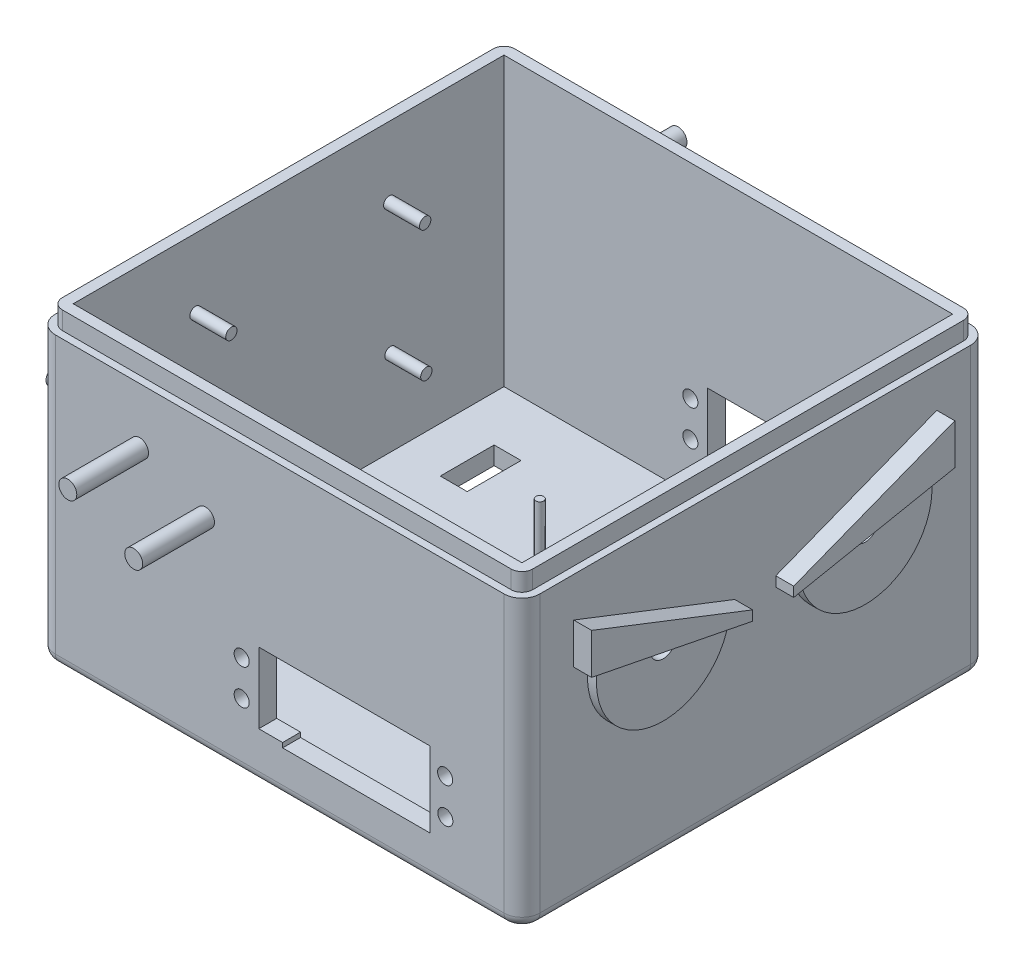
from build123d import *

# Parameters (mm, degrees)
SKETCH1_W               = 135
SKETCH1_H               = 130
BOSS_EXTRUDE1_DEPTH     = 80
FILLET3_R               = 5
SHELL4_START            = -60.909090909
SHELL4_OUTLINE_W        = 75
SHELL4_OUTLINE_H        = 120
SHELL4_DEPTH            = 125
BOSS_EXTRUDE5_DEPTH     = 5
SKETCH12_W              = 125
SKETCH12_H              = 120
CUT_EXTRUDE7_DEPTH      = 30
SKETCH51_R              = 2.1
SKETCH51_W              = 39.9
SKETCH51_H              = 19.7
CUT_EXTRUDE8_DEPTH      = 170.995746179
SKETCH52_R              = 2.5
BOSS_EXTRUDE29_DEPTH    = 20
BOSS_EXTRUDE30_START    = 20
SKETCH53_R              = 2.5
BOSS_EXTRUDE30_DEPTH    = 20
SKETCH54_R              = 1.097354929
SKETCH54_R_2            = 1.097354846
SKETCH54_R_3            = 1.097350713
SKETCH54_R_4            = 1.097352291
BOSS_EXTRUDE31_DEPTH    = 15
SKETCH55_R              = 1.493597511
SKETCH55_R_2            = 1.49359734
BOSS_EXTRUDE32_DEPTH    = 10
SKETCH56_R              = 2.923618592
BOSS_EXTRUDE33_DEPTH    = 5
SKETCH58_R              = 1.583892905
SKETCH58_R_2            = 1.583857327
SKETCH58_R_3            = 1.583793031
SKETCH58_R_4            = 1.583675268
BOSS_EXTRUDE35_DEPTH    = 10
SKETCH60_W              = 7.5
SKETCH60_H              = 15
CUT_EXTRUDE10_DEPTH     = 10
SKETCH61_R              = 8
BOSS_EXTRUDE36_DEPTH    = 5
SKETCH62_R              = 2.5
BOSS_EXTRUDE37_DEPTH    = 15
BOSS_EXTRUDE38_DEPTH    = 2.5
BOSS_EXTRUDE39_DEPTH    = 5
CUT_EXTRUDE11_DEPTH     = 5
FILLET4_R               = 3
CUT_EXTRUDE5_DEPTH      = 191.450206069
CUT_EXTRUDE5_DEPTH_BACK = 191.450206069
SKETCH14_W              = 41
SKETCH14_H              = 21
SKETCH38_R              = 2.499995695
BOSS_EXTRUDE19_DEPTH    = 20
SKETCH39_R              = 2.099929147
SKETCH39_R_2            = 2.1
CUT_EXTRUDE6_DEPTH      = 191.450206069
BOSS_EXTRUDE20_START    = 20
SKETCH40_R              = 2.499995695
BOSS_EXTRUDE20_DEPTH    = 20
SKETCH41_R              = 1.743340357
SKETCH41_R_2            = 1.74334297
SKETCH41_R_3            = 1.743341919
SKETCH41_R_4            = 1.743340762
BOSS_EXTRUDE21_DEPTH    = 10
SKETCH42_R              = 1.583857307
SKETCH42_R_2            = 1.583793042
SKETCH42_R_3            = 1.58367528
SKETCH42_R_4            = 1.583892837
BOSS_EXTRUDE22_DEPTH    = 10
SKETCH43_R              = 1.097354928
SKETCH43_R_2            = 1.097354845
SKETCH43_R_3            = 1.097350705
SKETCH43_R_4            = 1.097352292
BOSS_EXTRUDE23_DEPTH    = 15
SKETCH48_R              = 2.891630162
BOSS_EXTRUDE27_DEPTH    = 5
SKETCH49_R              = 1.493597522
SKETCH49_R_2            = 1.49359734
BOSS_EXTRUDE28_DEPTH    = 10


# Read off the part's stored shape, not the designer's step: Shell4
with BuildPart() as part:
    # Sketch1 → Boss-Extrude1 (new body)
    with BuildSketch(Plane(origin=(0, 0, 0), x_dir=(1, 0, 0), z_dir=(0, 1, 0))):
        with Locations((1.590909091, 2.110628243)):
            Rectangle(SKETCH1_W, SKETCH1_H)
    extrude(amount=BOSS_EXTRUDE1_DEPTH)

    # Fillet3
    fillet3_edges = [part.edges().sort_by_distance(p)[0] for p in [
        (-65.909090909, 40, -67.110628243),
        (69.090909091, 40, -67.110628243),
        (69.090909091, 40, 62.889371757),
        (-65.909090909, 40, 62.889371757),
    ]]
    fillet(fillet3_edges, radius=FILLET3_R)

    # Shell4 outline → Shell4 (cut)
    with BuildSketch(Plane.YZ.offset(SHELL4_START)):
        with Locations((42.5, -2.110628243)):
            Rectangle(SHELL4_OUTLINE_W, SHELL4_OUTLINE_H)
    extrude(amount=SHELL4_DEPTH, mode=Mode.SUBTRACT)

    # Sketch6 → Boss-Extrude5 (add)
    with BuildSketch(Plane(origin=(0, 80, 0), x_dir=(1, 0, 0), z_dir=(0, 1, 0))):
        with BuildLine():
            Line((-60.909090909, -60.889371757), (64.090909091, -60.889371757))
            ThreePointArc((64.090909091, -60.889371757), (66.212229434, -60.010692101), (67.090909091, -57.889371757))
            Line((67.090909091, -57.889371757), (67.090909091, 62.110628243))
            ThreePointArc((67.090909091, 62.110628243), (66.212229434, 64.231948586), (64.090909091, 65.110628243))
            Line((64.090909091, 65.110628243), (-60.909090909, 65.110628243))
            ThreePointArc((-60.909090909, 65.110628243), (-63.030411253, 64.231948586), (-63.909090909, 62.110628243))
            Line((-63.909090909, 62.110628243), (-63.909090909, -57.889371757))
            ThreePointArc((-63.909090909, -57.889371757), (-63.030411253, -60.010692101), (-60.909090909, -60.889371757))
        make_face()
    extrude(amount=BOSS_EXTRUDE5_DEPTH)

    # Sketch12 → Cut-Extrude7 (cut)
    with BuildSketch(Plane(origin=(0, 85, 0), x_dir=(1, 0, 0), z_dir=(0, 1, 0))):
        with Locations((1.590909091, 2.110628243)):
            Rectangle(SKETCH12_W, SKETCH12_H)
    extrude(amount=-CUT_EXTRUDE7_DEPTH, mode=Mode.SUBTRACT)

    # Sketch51 → Cut-Extrude8 (cut, through all)
    with BuildSketch(Plane.XY.offset(62.889371757)):
        with Locations((-8.984223689, 28.081935568)):
            Circle(SKETCH51_R)
        with Locations((-8.984223689, 18.231935568)):
            Circle(SKETCH51_R)
        with Locations((40.438067547, 28.081935568)):
            Circle(SKETCH51_R)
        with Locations((40.438067547, 18.231935568)):
            Circle(SKETCH51_R)
        with Locations((15.726921929, 23.156935568)):
            Rectangle(SKETCH51_W, SKETCH51_H)
    extrude(amount=-CUT_EXTRUDE8_DEPTH, mode=Mode.SUBTRACT)

    # Sketch52 → Boss-Extrude29 (add)
    with BuildSketch(Plane.XY.offset(62.889371757)):
        with Locations(Location((-37.424099567, 64.448146968, 0), (0, 0, 180))):
            Circle(SKETCH52_R)
    extrude(amount=BOSS_EXTRUDE29_DEPTH)

    # Sketch53 → Boss-Extrude30 (add)
    with BuildSketch(Plane(origin=(0, 0, -67.110628243), x_dir=(-1, 0, 0), z_dir=(0, 0, -1)).offset(BOSS_EXTRUDE30_START)):
        with Locations((37.424099567, 64.448146968)):
            Circle(SKETCH53_R)
    extrude(amount=-BOSS_EXTRUDE30_DEPTH)

    # Sketch54 → Boss-Extrude31 (add)
    with BuildSketch(Plane(origin=(0, 5, 0), x_dir=(1, 0, 0), z_dir=(0, 1, 0))):
        with Locations(Location((-13.882974331, 25.052366393, 0), (0, 0, 270))):
            Circle(SKETCH54_R)
        with Locations(Location((37.009034905, 10.261178321, 0), (0, 0, 270))):
            Circle(SKETCH54_R_2)
        with Locations(Location((37.252493084, -17.646611168, 0), (0, 0, 270))):
            Circle(SKETCH54_R_3)
        with Locations(Location((-14.731567108, -23.178787611, 0), (0, 0, 270))):
            Circle(SKETCH54_R_4)
    extrude(amount=BOSS_EXTRUDE31_DEPTH)

    # Sketch55 → Boss-Extrude32 (add)
    with BuildSketch(Plane(origin=(0, 5, 0), x_dir=(1, 0, 0), z_dir=(0, 1, 0))):
        with Locations(Location((59.280875612, 10.746107148, 0), (0, 0, 270))):
            Circle(SKETCH55_R)
        with Locations(Location((59.381101783, -5.253577831, 0), (0, 0, 270))):
            Circle(SKETCH55_R_2)
    extrude(amount=BOSS_EXTRUDE32_DEPTH)

    # Sketch56 → Boss-Extrude33 (add)
    with BuildSketch(Plane(origin=(0, 5, 0), x_dir=(1, 0, 0), z_dir=(0, 1, 0))):
        with Locations(Location((54.807940882, 1.102663458, 0), (0, 0, 270))):
            Circle(SKETCH56_R)
    extrude(amount=BOSS_EXTRUDE33_DEPTH)

    # Sketch58 → Boss-Extrude35 (add)
    with BuildSketch(Plane(origin=(-60.909090909, 0, 0), x_dir=(0, 0, -1), z_dir=(1, 0, 0))):
        with Locations((-23.825052013, 65.769783842)):
            Circle(SKETCH58_R)
        with Locations((30.159505374, 65.455170881)):
            Circle(SKETCH58_R_2)
        with Locations((30.483812669, 28.939401841)):
            Circle(SKETCH58_R_3)
        with Locations((-23.494114633, 28.460414527)):
            Circle(SKETCH58_R_4)
    extrude(amount=BOSS_EXTRUDE35_DEPTH)

    # Sketch60 → Cut-Extrude10 (cut)
    with BuildSketch(Plane(origin=(0, 5, 0), x_dir=(1, 0, 0), z_dir=(0, 1, 0))):
        with Locations((-43.894273907, -31.311500115)):
            Rectangle(SKETCH60_W, SKETCH60_H)
        with Locations((-44.460730283, 39.165032156)):
            Rectangle(SKETCH60_W, SKETCH60_H)
    extrude(amount=-CUT_EXTRUDE10_DEPTH, mode=Mode.SUBTRACT)

    # Sketch61 → Boss-Extrude36 (add)
    with BuildSketch(Plane.ZY.offset(65.909090909)):
        with Locations(Location((26.420628094, 32.425519239, 0), (0, 0, 180))):
            Circle(SKETCH61_R)
    extrude(amount=BOSS_EXTRUDE36_DEPTH)

    # Sketch62 → Boss-Extrude37 (add)
    with BuildSketch(Plane.ZY.offset(65.909090909)):
        with Locations(Location((2.979358583, 50.286508583, 0), (0, 0, 180))):
            Circle(SKETCH62_R)
        with Locations(Location((42.979358583, 50.286508583, 0), (0, 0, 180))):
            Circle(SKETCH62_R)
        with Locations(Location((41.91526883, 10.864110099, 0), (0, 0, 180))):
            Circle(SKETCH62_R)
        with Locations(Location((2.979358583, 10.441006071, 0), (0, 0, 180))):
            Circle(SKETCH62_R)
    extrude(amount=BOSS_EXTRUDE37_DEPTH)

    # Sketch66 → Boss-Extrude38 (add)
    with BuildSketch(Plane(origin=(69.090909091, 0, 0), x_dir=(0, 0, -1), z_dir=(1, 0, 0))):
        with BuildLine():
            Line((-44.270425373, 56.797242998), (-7.812088138, 49.599459681))
            ThreePointArc((-7.812088138, 49.599459681), (-29.640148414, 34.969182723), (-44.270425373, 56.797242998))
        make_face()
    boss_extrude38 = extrude(amount=BOSS_EXTRUDE38_DEPTH)

    # Sketch64 → Boss-Extrude39 (add)
    with BuildSketch(Plane(origin=(69.090909091, 0, 0), x_dir=(0, 0, -1), z_dir=(1, 0, 0))):
        Polygon((-48.473573965, 68.982815523), (-48.473573965, 57.627049158), (-3.608939546, 48.769653522), (-3.608939546, 51.506862595), align=None)
    boss_extrude39 = extrude(amount=BOSS_EXTRUDE39_DEPTH)

    # Sketch69 → Cut-Extrude11 (cut)
    with BuildSketch(Plane(origin=(69.090909091, 0, 0), x_dir=(0, 0, -1), z_dir=(1, 0, 0))):
        with BuildLine():
            Line((-29.513282432, 53.883815636), (-22.569231079, 52.512887043))
            ThreePointArc((-22.569231079, 52.512887043), (-26.726721052, 49.726325664), (-29.513282432, 53.883815636))
        make_face()
    cut_extrude11 = extrude(amount=CUT_EXTRUDE11_DEPTH, mode=Mode.SUBTRACT)

    # Mirror3: Boss-Extrude38, Boss-Extrude39, Cut-Extrude11 across plane
    add(boss_extrude38.mirror(Plane.XY.offset(-2.110628243)))
    add(boss_extrude39.mirror(Plane.XY.offset(-2.110628243)))
    add(cut_extrude11.mirror(Plane.XY.offset(-2.110628243)), mode=Mode.SUBTRACT)

    # Fillet4
    fillet4_edges = [part.edges().sort_by_distance(p)[0] for p in [
        (69.090909091, 0, -2.110628243),
        (-65.909090909, 0, -2.110628243),
        (1.590909091, 0, -67.110628243),
        (1.590909091, 0, 62.889371757),
        (-64.444624815, 0, -65.646162149),
        (67.626442997, 0, -65.646162149),
        (-64.444624815, 0, 61.424905663),
        (67.626442997, 0, 61.424905663),
    ]]
    fillet(fillet4_edges, radius=FILLET4_R)

    # Sketch14 → Cut-Extrude5 (cut, two sides: drawn at the far end of the back side and taken through both)
    with BuildSketch(Plane(origin=(0, 0, -67.110628243), x_dir=(-1, 0, 0), z_dir=(0, 0, -1)).offset(-CUT_EXTRUDE5_DEPTH_BACK)):
        with Locations((-22.915856751, 22.506935568)):
            Rectangle(SKETCH14_W, SKETCH14_H)
    extrude(amount=CUT_EXTRUDE5_DEPTH + CUT_EXTRUDE5_DEPTH_BACK, mode=Mode.SUBTRACT)

    # Sketch38 → Boss-Extrude19 (add)
    with BuildSketch(Plane.XY.offset(62.889371757)):
        with Locations(Location((-19.064354595, 56.892914504, 0), (0, 0, 180))):
            Circle(SKETCH38_R)
    extrude(amount=BOSS_EXTRUDE19_DEPTH)

    # Sketch39 → Cut-Extrude6 (cut, through all)
    with BuildSketch(Plane.XY.offset(62.889371757)):
        with Locations((47.698527272, 27.837999273)):
            Circle(SKETCH39_R)
        with Locations((47.753956504, 17.988233098)):
            Circle(SKETCH39_R)
        with Locations((-1.666283345, 17.711534904)):
            Circle(SKETCH39_R_2)
        with Locations((-1.704515098, 27.570940529)):
            Circle(SKETCH39_R)
    extrude(amount=-CUT_EXTRUDE6_DEPTH, mode=Mode.SUBTRACT)

    # Sketch40 → Boss-Extrude20 (add)
    with BuildSketch(Plane(origin=(0, 0, -67.110628243), x_dir=(-1, 0, 0), z_dir=(0, 0, -1)).offset(BOSS_EXTRUDE20_START)):
        with Locations((19.064354595, 56.892914504)):
            Circle(SKETCH40_R)
    extrude(amount=-BOSS_EXTRUDE20_DEPTH)

    # Sketch41 → Boss-Extrude21 (add)
    with BuildSketch(Plane.ZY.offset(65.909090909)):
        with Locations(Location((-52.504515626, 59.75868372, 0), (0, 0, 180))):
            Circle(SKETCH41_R)
        with Locations(Location((15.528981547, 62.790814483, 0), (0, 0, 180))):
            Circle(SKETCH41_R_2)
        with Locations(Location((-15.204516125, 18.75868119, 0), (0, 0, 180))):
            Circle(SKETCH41_R_3)
        with Locations(Location((-52.504515626, 18.758684916, 0), (0, 0, 180))):
            Circle(SKETCH41_R_4)
    extrude(amount=BOSS_EXTRUDE21_DEPTH)

    # Sketch42 → Boss-Extrude22 (add)
    with BuildSketch(Plane(origin=(-60.909090909, 0, 0), x_dir=(0, 0, -1), z_dir=(1, 0, 0))):
        with Locations((30.15950535, 65.45517088)):
            Circle(SKETCH42_R)
        with Locations((30.483812669, 28.939401841)):
            Circle(SKETCH42_R_2)
        with Locations(Location((-23.494114636, 28.460414515, 0), (0, 0, 4.3e-07))):
            Circle(SKETCH42_R_3)
        with Locations(Location((-23.825052085, 65.769783916, 0), (0, 0, 359.999997299))):
            Circle(SKETCH42_R_4)
    extrude(amount=BOSS_EXTRUDE22_DEPTH)

    # Sketch43 → Boss-Extrude23 (add)
    with BuildSketch(Plane(origin=(0, 5, 0), x_dir=(1, 0, 0), z_dir=(0, 1, 0))):
        with Locations(Location((-13.882974331, 25.052366393, 0), (0, 0, 270))):
            Circle(SKETCH43_R)
        with Locations(Location((37.009034905, 10.261178321, 0), (0, 0, 270))):
            Circle(SKETCH43_R_2)
        with Locations(Location((37.252493084, -17.646611168, 0), (0, 0, 270))):
            Circle(SKETCH43_R_3)
        with Locations(Location((-14.731567108, -23.178787611, 0), (0, 0, 270))):
            Circle(SKETCH43_R_4)
    extrude(amount=BOSS_EXTRUDE23_DEPTH)

    # Sketch48 → Boss-Extrude27 (add)
    with BuildSketch(Plane(origin=(0, 5, 0), x_dir=(1, 0, 0), z_dir=(0, 1, 0))):
        with Locations((57.255468538, 0.912765664)):
            Circle(SKETCH48_R)
    extrude(amount=BOSS_EXTRUDE27_DEPTH)

    # Sketch49 → Boss-Extrude28 (add)
    with BuildSketch(Plane(origin=(0, 5, 0), x_dir=(1, 0, 0), z_dir=(0, 1, 0))):
        with Locations(Location((59.280875612, 10.746107148, 0), (0, 0, 270))):
            Circle(SKETCH49_R)
        with Locations(Location((59.381101783, -5.253577831, 0), (0, 0, 270))):
            Circle(SKETCH49_R_2)
    extrude(amount=BOSS_EXTRUDE28_DEPTH)


solid = part.part
